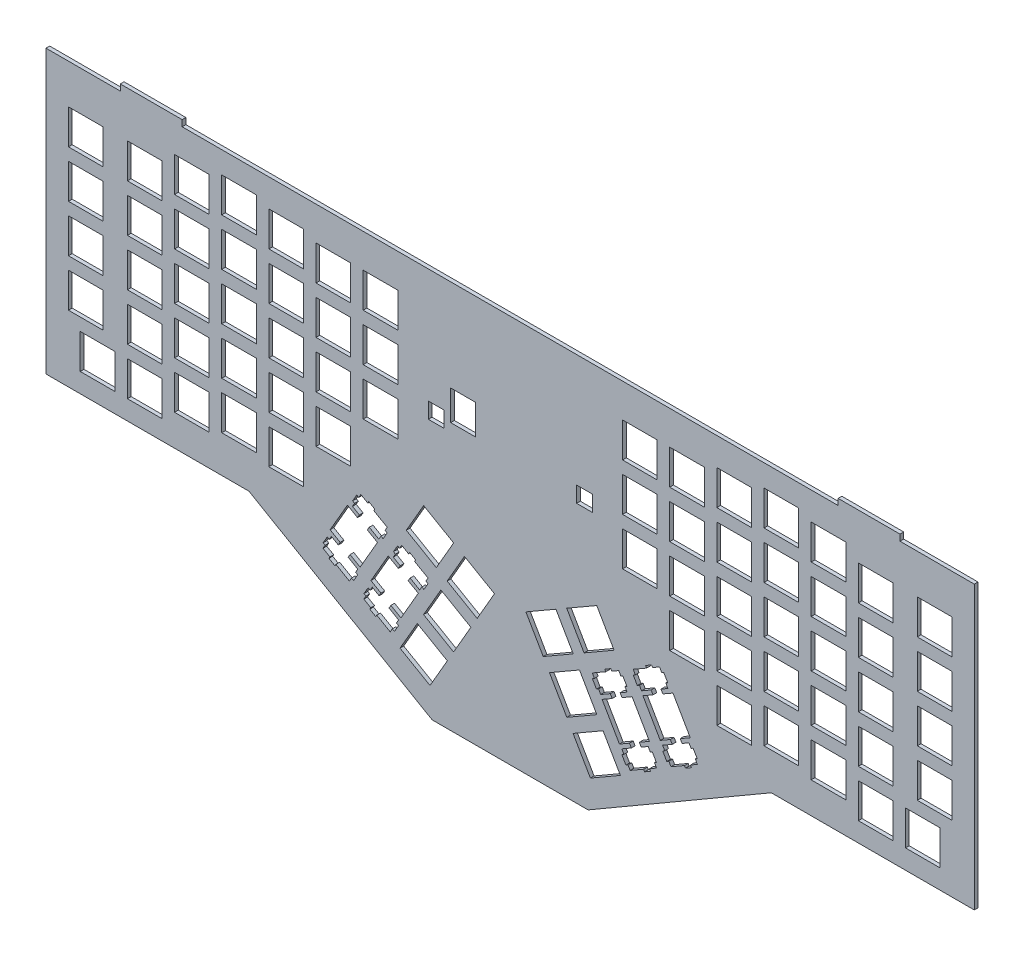
from build123d import *

# Parameters (mm, degrees)
MODEL_W              = 371.4749154
MODEL_H              = 142.533331
MODEL_W_2            = 13.9994
MODEL_H_2            = 14.0007
MODEL_W_3            = 13.9993
MODEL_W_4            = 13.999
MODEL_H_3            = 13.9993
MODEL_W_5            = 13.99954
MODEL_W_6            = 14
MODEL_H_4            = 13.999
MODEL_H_5            = 14.001
MODEL_H_6            = 14
BOSS_EXTRUDE1_DEPTH  = 1.5
SKETCH1_W            = 371.4749154
SKETCH1_H            = 1.5
BOSS_EXTRUDE2_DEPTH  = 5.46
SKETCH2_W            = 371.4749154
SKETCH2_H            = 1.5
BOSS_EXTRUDE3_DEPTH  = 8.2
SKETCH6_W            = 1.5
SKETCH6_H            = 156.193331
BOSS_EXTRUDE5_DEPTH  = 2
SKETCH9_W            = 1.5
SKETCH9_H            = 156.193331
BOSS_EXTRUDE8_DEPTH  = 10
SKETCH7_W            = 383.4749154
SKETCH7_H            = 1.5
BOSS_EXTRUDE9_DEPTH  = 10
CUT_EXTRUDE1_DEPTH   = 10
SKETCH4_W            = 6.4
SKETCH4_H            = 6.4
SKETCH4_W_2          = 10
SKETCH4_H_2          = 12.12
SKETCH4_H_3          = 6.408848303
CUT_EXTRUDE2_DEPTH   = 2
SKETCH11_W           = 25
SKETCH11_H           = 1.5
BOSS_EXTRUDE10_DEPTH = 2.5


with BuildPart() as part:
    # Model → Boss-Extrude1 (new body)
    with BuildSketch(Plane.XY):
        with Locations((185.8325423, 71.5133345)):
            Rectangle(MODEL_W, MODEL_H)
        Polygon((141.314, 10.6977), (153.439, 3.69729), (160.438, 15.8213), (148.314, 22.8217), align=None, mode=Mode.SUBTRACT)
        Polygon((211.224, 15.8213), (218.225, 3.69729), (230.35, 10.6977), (223.35, 22.8217), align=None, mode=Mode.SUBTRACT)
        Polygon((141.126, 45.533), (140.33, 45.992), (138.679, 43.1341), (139.477, 42.6752), (138.614, 41.1812), (141.412, 39.5661), (140.648, 38.2461), (136.579, 40.5955), (129.578, 28.4716), (133.649, 26.1221), (132.887, 24.8006), (130.09, 26.4156), (129.227, 24.9218), (128.429, 25.3821), (126.78, 22.524), (127.576, 22.0638), (126.715, 20.57), (129.512, 18.9549), (129.099, 18.2411), (131.524, 16.841), (131.936, 17.5548), (137.367, 14.4198), (138.228, 15.9136), (139.077, 15.423), (140.728, 18.2811), (139.879, 18.773), (140.742, 20.2654), (136.871, 22.5006), (137.633, 23.8221), (141.702, 21.4712), (148.703, 33.5952), (144.632, 35.9463), (145.396, 37.2664), (149.266, 35.0311), (150.129, 36.5248), (150.978, 36.0345), (152.628, 38.8923), (151.778, 39.3831), (152.641, 40.8767), (147.212, 44.0119), (147.624, 44.7269), (145.198, 46.1271), (144.786, 45.412), (141.989, 47.027), align=None, mode=Mode.SUBTRACT)
        Polygon((226.876, 45.412), (226.464, 46.1271), (224.04, 44.7269), (224.452, 44.0119), (219.021, 40.8767), (219.884, 39.3831), (219.035, 38.8923), (220.686, 36.0345), (221.535, 36.5248), (222.396, 35.0311), (226.267, 37.2664), (227.031, 35.9463), (222.961, 33.5952), (229.96, 21.4712), (234.031, 23.8221), (234.793, 22.5006), (230.922, 20.2654), (231.785, 18.773), (230.936, 18.2811), (232.585, 15.423), (233.434, 15.9136), (234.297, 14.4198), (239.726, 17.5548), (240.14, 16.841), (242.565, 18.2411), (242.152, 18.9549), (244.949, 20.57), (244.086, 22.0638), (244.883, 22.524), (243.233, 25.3821), (242.437, 24.9218), (241.573, 26.4156), (238.777, 24.8006), (238.014, 26.1221), (242.084, 28.4716), (235.085, 40.5955), (231.014, 38.2461), (230.251, 39.5661), (233.048, 41.1812), (232.187, 42.6752), (232.984, 43.1341), (231.334, 45.992), (230.536, 45.533), (229.674, 47.027), align=None, mode=Mode.SUBTRACT)
        Polygon((150.839, 27.1942), (162.964, 20.1952), (169.963, 32.3191), (157.839, 39.3196), align=None, mode=Mode.SUBTRACT)
        Polygon((201.699, 32.3191), (208.7, 20.1952), (220.825, 27.1942), (213.825, 39.3196), align=None, mode=Mode.SUBTRACT)
        Polygon((124.627, 55.058), (123.832, 55.517), (122.182, 52.6591), (122.979, 52.2002), (122.116, 50.7062), (124.912, 49.0911), (124.15, 47.7711), (120.081, 50.1206), (113.08, 37.9966), (117.151, 35.6471), (116.389, 34.3256), (113.592, 35.9406), (112.729, 34.4468), (111.933, 34.9071), (110.283, 32.0491), (111.078, 31.5888), (110.217, 30.095), (113.013, 28.4799), (112.601, 27.7661), (115.025, 26.366), (115.438, 27.0798), (120.869, 23.9448), (121.731, 25.4386), (122.579, 24.948), (124.229, 27.806), (123.38, 28.2966), (124.244, 29.7904), (120.373, 32.0256), (121.135, 33.3471), (125.204, 30.9962), (132.205, 43.12), (128.134, 45.4713), (128.898, 46.7914), (132.769, 44.5562), (133.631, 46.0498), (134.48, 45.5595), (136.13, 48.4173), (135.281, 48.9081), (136.143, 50.4017), (130.714, 53.5368), (131.126, 54.2519), (128.702, 55.6521), (128.288, 54.937), (125.491, 56.552), align=None, mode=Mode.SUBTRACT)
        Polygon((243.374, 54.937), (242.962, 55.6521), (240.538, 54.2519), (240.95, 53.5368), (235.519, 50.4017), (236.383, 48.9081), (235.533, 48.4173), (237.184, 45.5595), (238.033, 46.0498), (238.894, 44.5562), (242.765, 46.7914), (243.528, 45.4713), (239.457, 43.12), (246.458, 30.9962), (250.527, 33.3471), (251.291, 32.0256), (247.42, 29.7904), (248.283, 28.2966), (247.434, 27.806), (249.083, 24.948), (249.932, 25.4386), (250.795, 23.9448), (256.224, 27.0798), (256.638, 26.366), (259.062, 27.7661), (258.65, 28.4799), (261.447, 30.095), (260.584, 31.5888), (261.381, 32.0491), (259.73, 34.9071), (258.935, 34.4468), (258.072, 35.9406), (255.275, 34.3256), (254.51, 35.6471), (258.582, 37.9966), (251.583, 50.1206), (247.512, 47.7711), (246.75, 49.0911), (249.546, 50.7062), (248.685, 52.2002), (249.48, 52.6591), (247.831, 55.517), (247.034, 55.058), (246.172, 56.552), align=None, mode=Mode.SUBTRACT)
        Polygon((160.364, 43.6922), (172.489, 36.6931), (179.488, 48.817), (167.364, 55.8176), align=None, mode=Mode.SUBTRACT)
        Polygon((192.174, 48.817), (199.175, 36.6931), (211.3, 43.6922), (204.3, 55.8176), align=None, mode=Mode.SUBTRACT)
        with Locations((19.1444, 49.91255)):
            Rectangle(MODEL_W_2, MODEL_H_2, mode=Mode.SUBTRACT)
        with Locations((38.19435, 49.91255)):
            Rectangle(MODEL_W_3, MODEL_H_2, mode=Mode.SUBTRACT)
        with Locations((333.4695, 49.91255)):
            Rectangle(MODEL_W_4, MODEL_H_2, mode=Mode.SUBTRACT)
        with Locations((352.5195, 49.91255)):
            Rectangle(MODEL_W_4, MODEL_H_2, mode=Mode.SUBTRACT)
        Polygon((143.866, 53.2172), (155.991, 46.2181), (162.99, 58.342), (150.865, 65.3426), align=None, mode=Mode.SUBTRACT)
        Polygon((208.672, 58.342), (215.672, 46.2181), (227.798, 53.2172), (220.798, 65.3426), align=None, mode=Mode.SUBTRACT)
        with Locations((57.24435, 54.67435)):
            Rectangle(MODEL_W_3, MODEL_H_3, mode=Mode.SUBTRACT)
        with Locations((95.34435, 54.67435)):
            Rectangle(MODEL_W_3, MODEL_H_3, mode=Mode.SUBTRACT)
        with Locations((276.3195, 54.67435)):
            Rectangle(MODEL_W_4, MODEL_H_3, mode=Mode.SUBTRACT)
        with Locations((314.4195, 54.67435)):
            Rectangle(MODEL_W_4, MODEL_H_3, mode=Mode.SUBTRACT)
        with Locations((76.29435, 57.05565)):
            Rectangle(MODEL_W_3, MODEL_H_3, mode=Mode.SUBTRACT)
        with Locations((295.3695, 57.05565)):
            Rectangle(MODEL_W_4, MODEL_H_3, mode=Mode.SUBTRACT)
        with Locations((14.38193, 68.96255)):
            Rectangle(MODEL_W_5, MODEL_H_2, mode=Mode.SUBTRACT)
        with Locations((38.19435, 68.96255)):
            Rectangle(MODEL_W_3, MODEL_H_2, mode=Mode.SUBTRACT)
        with Locations((333.4695, 68.96255)):
            Rectangle(MODEL_W_4, MODEL_H_2, mode=Mode.SUBTRACT)
        with Locations((357.282, 68.96255)):
            Rectangle(MODEL_W_6, MODEL_H_2, mode=Mode.SUBTRACT)
        with Locations((114.3945, 71.34315)):
            Rectangle(MODEL_W_4, MODEL_H_3, mode=Mode.SUBTRACT)
        with Locations((257.2695, 71.34315)):
            Rectangle(MODEL_W_4, MODEL_H_3, mode=Mode.SUBTRACT)
        with Locations((57.24435, 73.72435)):
            Rectangle(MODEL_W_3, MODEL_H_3, mode=Mode.SUBTRACT)
        with Locations((95.34435, 73.72435)):
            Rectangle(MODEL_W_3, MODEL_H_3, mode=Mode.SUBTRACT)
        with Locations((276.3195, 73.72435)):
            Rectangle(MODEL_W_4, MODEL_H_3, mode=Mode.SUBTRACT)
        with Locations((314.4195, 73.72435)):
            Rectangle(MODEL_W_4, MODEL_H_3, mode=Mode.SUBTRACT)
        with Locations((76.29435, 76.10565)):
            Rectangle(MODEL_W_3, MODEL_H_3, mode=Mode.SUBTRACT)
        with Locations((295.3695, 76.10565)):
            Rectangle(MODEL_W_4, MODEL_H_3, mode=Mode.SUBTRACT)
        with Locations((14.38193, 88.01255)):
            Rectangle(MODEL_W_5, MODEL_H_2, mode=Mode.SUBTRACT)
        with Locations((38.19435, 88.01255)):
            Rectangle(MODEL_W_3, MODEL_H_2, mode=Mode.SUBTRACT)
        with Locations((333.4695, 88.01255)):
            Rectangle(MODEL_W_4, MODEL_H_2, mode=Mode.SUBTRACT)
        with Locations((357.282, 88.01255)):
            Rectangle(MODEL_W_6, MODEL_H_2, mode=Mode.SUBTRACT)
        with Locations((114.3945, 90.39315)):
            Rectangle(MODEL_W_4, MODEL_H_3, mode=Mode.SUBTRACT)
        with Locations((133.4445, 90.39315)):
            Rectangle(MODEL_W_4, MODEL_H_3, mode=Mode.SUBTRACT)
        with Locations((238.2195, 90.39315)):
            Rectangle(MODEL_W_4, MODEL_H_3, mode=Mode.SUBTRACT)
        with Locations((257.2695, 90.39315)):
            Rectangle(MODEL_W_4, MODEL_H_3, mode=Mode.SUBTRACT)
        with Locations((57.24435, 92.77435)):
            Rectangle(MODEL_W_3, MODEL_H_3, mode=Mode.SUBTRACT)
        with Locations((95.34435, 92.77435)):
            Rectangle(MODEL_W_3, MODEL_H_3, mode=Mode.SUBTRACT)
        with Locations((276.3195, 92.77435)):
            Rectangle(MODEL_W_4, MODEL_H_3, mode=Mode.SUBTRACT)
        with Locations((314.4195, 92.77435)):
            Rectangle(MODEL_W_4, MODEL_H_3, mode=Mode.SUBTRACT)
        with Locations((76.29435, 95.1555)):
            Rectangle(MODEL_W_3, MODEL_H_4, mode=Mode.SUBTRACT)
        with Locations((295.3695, 95.1555)):
            Rectangle(MODEL_W_4, MODEL_H_4, mode=Mode.SUBTRACT)
        with Locations((14.38193, 107.0625)):
            Rectangle(MODEL_W_5, MODEL_H_5, mode=Mode.SUBTRACT)
        with Locations((38.19435, 107.0625)):
            Rectangle(MODEL_W_3, MODEL_H_5, mode=Mode.SUBTRACT)
        with Locations((333.4695, 107.0625)):
            Rectangle(MODEL_W_4, MODEL_H_5, mode=Mode.SUBTRACT)
        with Locations((357.282, 107.0625)):
            Rectangle(MODEL_W_6, MODEL_H_5, mode=Mode.SUBTRACT)
        with Locations((114.3945, 109.443)):
            Rectangle(MODEL_W_4, MODEL_H_6, mode=Mode.SUBTRACT)
        with Locations((133.4445, 109.443)):
            Rectangle(MODEL_W_4, MODEL_H_6, mode=Mode.SUBTRACT)
        with Locations((238.2195, 109.443)):
            Rectangle(MODEL_W_4, MODEL_H_6, mode=Mode.SUBTRACT)
        with Locations((257.2695, 109.443)):
            Rectangle(MODEL_W_4, MODEL_H_6, mode=Mode.SUBTRACT)
        with Locations((57.24435, 111.8245)):
            Rectangle(MODEL_W_3, MODEL_H_4, mode=Mode.SUBTRACT)
        with Locations((95.34435, 111.8245)):
            Rectangle(MODEL_W_3, MODEL_H_4, mode=Mode.SUBTRACT)
        with Locations((276.3195, 111.8245)):
            Rectangle(MODEL_W_4, MODEL_H_4, mode=Mode.SUBTRACT)
        with Locations((314.4195, 111.8245)):
            Rectangle(MODEL_W_4, MODEL_H_4, mode=Mode.SUBTRACT)
        with Locations((76.29435, 114.2055)):
            Rectangle(MODEL_W_3, MODEL_H_4, mode=Mode.SUBTRACT)
        with Locations((295.3695, 114.2055)):
            Rectangle(MODEL_W_4, MODEL_H_4, mode=Mode.SUBTRACT)
        with Locations((14.38193, 126.1125)):
            Rectangle(MODEL_W_5, MODEL_H_5, mode=Mode.SUBTRACT)
        with Locations((38.19435, 126.1125)):
            Rectangle(MODEL_W_3, MODEL_H_5, mode=Mode.SUBTRACT)
        with Locations((333.4695, 126.1125)):
            Rectangle(MODEL_W_4, MODEL_H_5, mode=Mode.SUBTRACT)
        with Locations((357.282, 126.1125)):
            Rectangle(MODEL_W_6, MODEL_H_5, mode=Mode.SUBTRACT)
        with Locations((114.3945, 128.493)):
            Rectangle(MODEL_W_4, MODEL_H_6, mode=Mode.SUBTRACT)
        with Locations((133.4445, 128.493)):
            Rectangle(MODEL_W_4, MODEL_H_6, mode=Mode.SUBTRACT)
        with Locations((238.2195, 128.493)):
            Rectangle(MODEL_W_4, MODEL_H_6, mode=Mode.SUBTRACT)
        with Locations((257.2695, 128.493)):
            Rectangle(MODEL_W_4, MODEL_H_6, mode=Mode.SUBTRACT)
        with Locations((57.24435, 130.8745)):
            Rectangle(MODEL_W_3, MODEL_H_4, mode=Mode.SUBTRACT)
        with Locations((95.34435, 130.8745)):
            Rectangle(MODEL_W_3, MODEL_H_4, mode=Mode.SUBTRACT)
        with Locations((276.3195, 130.8745)):
            Rectangle(MODEL_W_4, MODEL_H_4, mode=Mode.SUBTRACT)
        with Locations((314.4195, 130.8745)):
            Rectangle(MODEL_W_4, MODEL_H_4, mode=Mode.SUBTRACT)
        with Locations((76.29435, 133.2555)):
            Rectangle(MODEL_W_3, MODEL_H_4, mode=Mode.SUBTRACT)
        with Locations((295.3695, 133.2555)):
            Rectangle(MODEL_W_4, MODEL_H_4, mode=Mode.SUBTRACT)
    extrude(amount=BOSS_EXTRUDE1_DEPTH)

    # Sketch1 → Boss-Extrude2 (add)
    with BuildSketch(Plane(origin=(0, 142.78, 0), x_dir=(1, 0, 0), z_dir=(0, 1, 0))):
        with Locations((185.8325423, -0.75)):
            Rectangle(SKETCH1_W, SKETCH1_H)
    extrude(amount=BOSS_EXTRUDE2_DEPTH)

    # Sketch2 → Boss-Extrude3 (add)
    with BuildSketch(Plane.XZ.offset(-0.246669)):
        with Locations((185.8325423, 0.75)):
            Rectangle(SKETCH2_W, SKETCH2_H)
    extrude(amount=BOSS_EXTRUDE3_DEPTH)

    # Sketch6 → Boss-Extrude5 (add)
    with BuildSketch(Plane(origin=(371.57, 0, 0), x_dir=(0, 0, -1), z_dir=(1, 0, 0))):
        with Locations((-0.75, 70.1433345)):
            Rectangle(SKETCH6_W, SKETCH6_H)
    extrude(amount=BOSS_EXTRUDE5_DEPTH)

    # Sketch9 → Boss-Extrude8 (add)
    with BuildSketch(Plane.ZY.offset(-0.0950846)):
        with Locations((0.75, 70.1433345)):
            Rectangle(SKETCH9_W, SKETCH9_H)
    extrude(amount=BOSS_EXTRUDE8_DEPTH)

    # Sketch7 → Boss-Extrude9 (add)
    with BuildSketch(Plane(origin=(0, 148.24, 0), x_dir=(1, 0, 0), z_dir=(0, 1, 0))):
        with Locations((181.8325423, -0.75)):
            Rectangle(SKETCH7_W, SKETCH7_H)
    extrude(amount=BOSS_EXTRUDE9_DEPTH)

    # Sketch10 → Cut-Extrude1 (cut)
    with BuildSketch(Plane(origin=(0, 0, 0), x_dir=(-1, 0, 0), z_dir=(0, 0, -1))):
        Polygon((9.9049154, -7.953331), (9.9049154, 158.24), (-373.57, 158.24), (-373.57, 149.098786614), (-373.57, -7.953331), (-154.311746614, -7.953331), align=None)
        Polygon((-373.311746614, 149.098786614), (1.688253386, 149.098786614), (1.688253386, 35.098786614), (-80.311746614, 35.098786614), (-154.311746614, -7.901213386), (-217.311746614, -7.901213386), (-291.311746614, 35.098786614), (-373.311746614, 35.098786614), align=None, mode=Mode.SUBTRACT)
    extrude(amount=-CUT_EXTRUDE1_DEPTH, mode=Mode.SUBTRACT)

    # Sketch4 → Cut-Extrude2 (cut)
    with BuildSketch(Plane.XY.offset(1.5)):
        with Locations((155.961746614, 99.688786614)):
            Rectangle(SKETCH4_W, SKETCH4_H)
        with Locations((166.796746614, 105.898786614)):
            Rectangle(SKETCH4_W_2, SKETCH4_H_2)
        with Locations((215.861746614, 100.238786615)):
            Rectangle(SKETCH4_W, SKETCH4_H_3)
    extrude(amount=-CUT_EXTRUDE2_DEPTH, mode=Mode.SUBTRACT)

    # Sketch11 → Boss-Extrude10 (add)
    with BuildSketch(Plane(origin=(0, 149.098786614, 0), x_dir=(1, 0, 0), z_dir=(0, 1, 0))):
        with Locations((40.811746614, -0.75)):
            Rectangle(SKETCH11_W, SKETCH11_H)
        with Locations((330.811746614, -0.75)):
            Rectangle(SKETCH11_W, SKETCH11_H)
    extrude(amount=BOSS_EXTRUDE10_DEPTH)


solid = part.part
